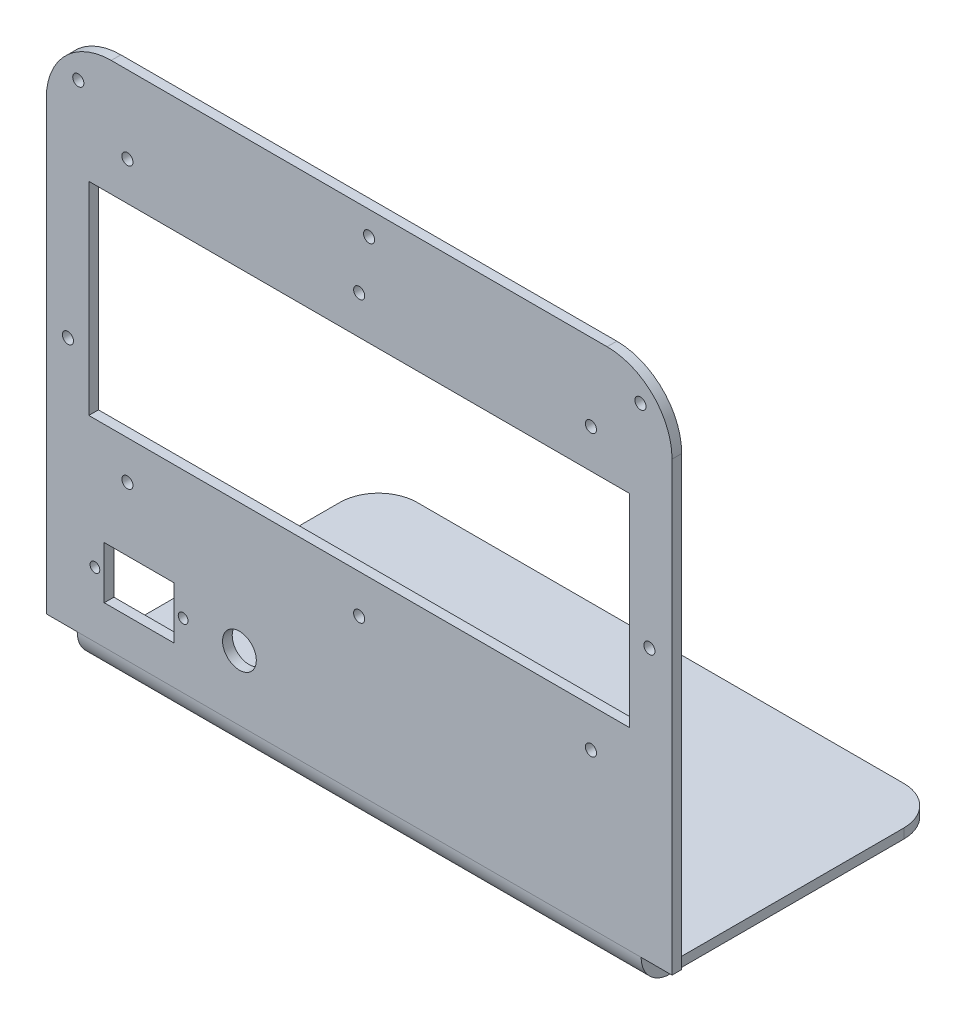
from build123d import *

# Parameters (mm, degrees)
BASE_FLANGE1_DEPTH          = 102.87
SKETCH6_W                   = 9.525
SKETCH6_H                   = 99.06
CUT_EXTRUDE1_DEPTH          = 10.16
FILLET1_R                   = 21.336
FILLET2_R                   = 12.7
SKETCH8_W                   = 177.8
SKETCH8_H                   = 66.675
CUT_EXTRUDE2_DEPTH          = 10.16
F_27_0_144_DIAMETER_HOLE1_D = 3.6576
F_27_0_144_DIAMETER_HOLE2_D = 3.6576
CUT_EXTRUDE3_REACH          = 210.856
SKETCH17_R                  = 1.6
SKETCH17_W                  = 22.86
SKETCH17_H                  = 17.15
CUT_EXTRUDE4_REACH          = 210.856
SKETCH18_R                  = 5.5499


# Sheet-metal steps are written as plain solids
with BuildPart() as part:
    # Sketch1 → Base-Flange1 (new, symmetric)
    with BuildSketch(Plane.YZ):
        with BuildLine():
            Line((-25.4, -73.66), (-25.4, 15.875))
            ThreePointArc((-25.4, 15.875), (-22.610192091, 22.610192091), (-15.875, 25.4))
            Line((-15.875, 25.4), (152.4, 25.4))
            Line((152.4, 25.4), (152.4, 22.225))
            Line((152.4, 22.225), (-15.875, 22.225))
            ThreePointArc((-15.875, 22.225), (-20.365128061, 20.365128061), (-22.225, 15.875))
            Line((-22.225, 15.875), (-22.225, -73.66))
            Line((-22.225, -73.66), (-25.4, -73.66))
        make_face()
    extrude(amount=BASE_FLANGE1_DEPTH, both=True)

    # Sketch6 → Cut-Extrude1 (cut)
    with BuildSketch(Plane.YZ.offset(102.87)):
        with Locations((-20.6375, -24.13)):
            Rectangle(SKETCH6_W, SKETCH6_H)
    cut_extrude1 = extrude(amount=-CUT_EXTRUDE1_DEPTH, mode=Mode.SUBTRACT)

    # Mirror1: Cut-Extrude1 across plane
    add(cut_extrude1.mirror(Plane(origin=(0, 0, 0), x_dir=(0, 0, 1), z_dir=(1, 0, 0))), mode=Mode.SUBTRACT)

    # Fillet1
    fillet1_edges = [part.edges().sort_by_distance(p)[0] for p in [
        (102.87, 152.4, 23.8125),
        (-102.87, 152.4, 23.8125),
    ]]
    fillet(fillet1_edges, radius=FILLET1_R)

    # Fillet2
    fillet2_edges = [part.edges().sort_by_distance(p)[0] for p in [
        (92.71, -23.8125, -73.66),
        (-92.71, -23.8125, -73.66),
    ]]
    fillet(fillet2_edges, radius=FILLET2_R)

    # Sketch8 → Cut-Extrude2 (cut)
    with BuildSketch(Plane.XY.offset(25.4)):
        with Locations((0, 80.9625)):
            Rectangle(SKETCH8_W, SKETCH8_H)
    extrude(amount=-CUT_EXTRUDE2_DEPTH, mode=Mode.SUBTRACT)

    # #27 (0.144) Diameter Hole1 (through all)
    with Locations(Plane.XY.offset(25.4)):
        with Locations((-76.2, 127), (0, 127), (76.2, 127), (76.2, 34.925), (0, 34.925), (-76.2, 34.925)):
            Hole(F_27_0_144_DIAMETER_HOLE1_D / 2)

    # #27 (0.144) Diameter Hole2 (through all)
    with Locations(Plane.XY.offset(25.4)):
        with Locations((92.4814, 141.7574), (95.4278, 73.533), (95.4278, -25.273), (-95.758, -18.034), (-95.758, 66.294), (-92.3544, 141.351), (3.2512, 144.5768)):
            Hole(F_27_0_144_DIAMETER_HOLE2_D / 2)

    # Sketch17 → Cut-Extrude3 (cut, up to next)
    with BuildSketch(Plane.XY.offset(25.4), mode=Mode.PRIVATE) as cut_extrude3_sk1:
        with Locations((-86.89, 5.4)):
            Circle(SKETCH17_R)
    cut_extrude3_tool1 = extrude(cut_extrude3_sk1.sketch, amount=-CUT_EXTRUDE3_REACH, mode=Mode.PRIVATE) & part.part
    # Sketch17 → Cut-Extrude3 (cut, up to next)
    with BuildSketch(Plane.XY.offset(25.4), mode=Mode.PRIVATE) as cut_extrude3_sk2:
        with Locations((-57.89, 5.4)):
            Circle(SKETCH17_R)
    cut_extrude3_tool2 = extrude(cut_extrude3_sk2.sketch, amount=-CUT_EXTRUDE3_REACH, mode=Mode.PRIVATE) & part.part
    # Sketch17 → Cut-Extrude3 (cut, up to next)
    with BuildSketch(Plane.XY.offset(25.4), mode=Mode.PRIVATE) as cut_extrude3_sk3:
        with Locations((-72.39, 5.4)):
            Rectangle(SKETCH17_W, SKETCH17_H)
    cut_extrude3_tool3 = extrude(cut_extrude3_sk3.sketch, amount=-CUT_EXTRUDE3_REACH, mode=Mode.PRIVATE) & part.part
    add(cut_extrude3_tool1.solids().sort_by_distance((-86.89, 5.4, 25.4))[0], mode=Mode.SUBTRACT)
    add(cut_extrude3_tool2.solids().sort_by_distance((-57.89, 5.4, 25.4))[0], mode=Mode.SUBTRACT)
    add(cut_extrude3_tool3.solids().sort_by_distance((-72.39, 5.4, 25.4))[0], mode=Mode.SUBTRACT)

    # Sketch18 → Cut-Extrude4 (cut, up to next)
    with BuildSketch(Plane.XY.offset(25.4), mode=Mode.PRIVATE) as cut_extrude4_sk1:
        with Locations((-39.37, 5.4)):
            Circle(SKETCH18_R)
    cut_extrude4_tool1 = extrude(cut_extrude4_sk1.sketch, amount=-CUT_EXTRUDE4_REACH, mode=Mode.PRIVATE) & part.part
    add(cut_extrude4_tool1.solids().sort_by_distance((-39.37, 5.4, 25.4))[0], mode=Mode.SUBTRACT)


solid = part.part
